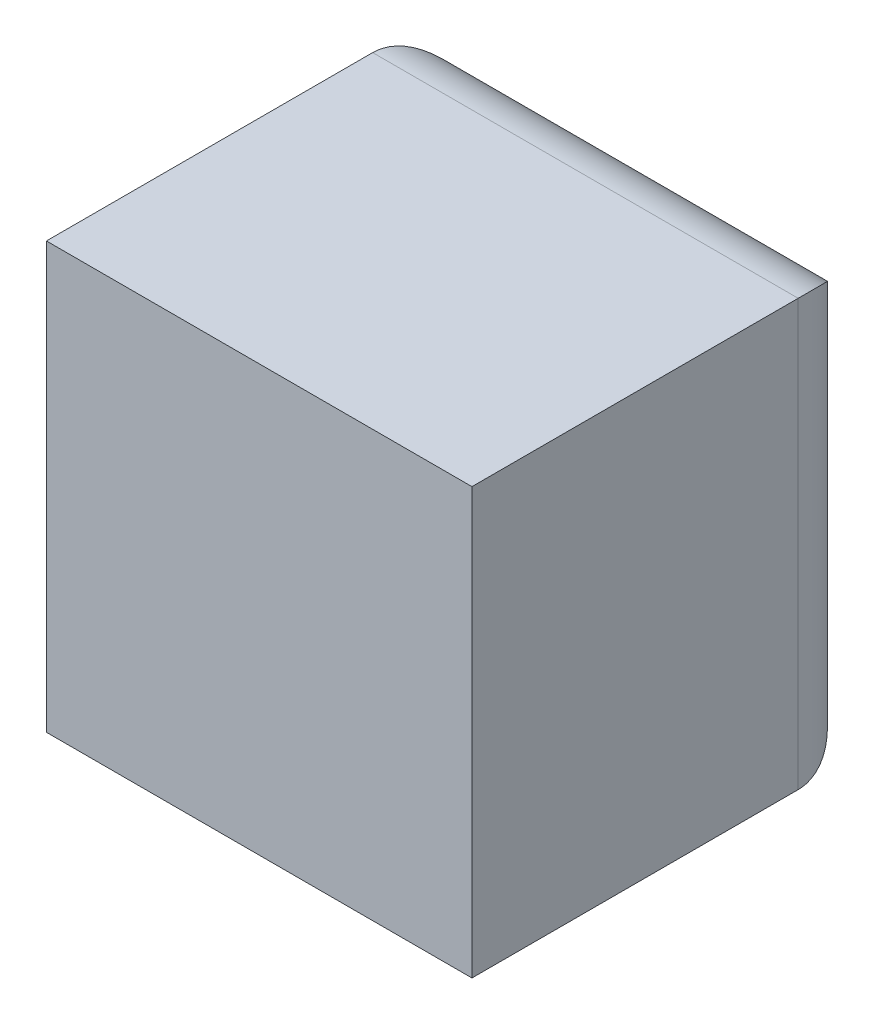
from build123d import *

# Parameters (mm, degrees)
SKETCH1_W           = 15
SKETCH1_H           = 15
BOSS_EXTRUDE1_DEPTH = 14
FILLET2_R           = 2.5


with BuildPart() as part:
    # Sketch1 → Boss-Extrude1 (new body)
    with BuildSketch(Plane.XY):
        with Locations((7.5, 7.5)):
            Rectangle(SKETCH1_W, SKETCH1_H)
    extrude(amount=BOSS_EXTRUDE1_DEPTH)

    # Fillet2
    fillet2_edges = [part.edges().sort_by_distance(p)[0] for p in [
        (7.5, 0, 0),
        (15, 7.5, 0),
        (7.5, 15, 0),
        (0, 7.5, 0),
    ]]
    fillet(fillet2_edges, radius=FILLET2_R)


solid = part.part
